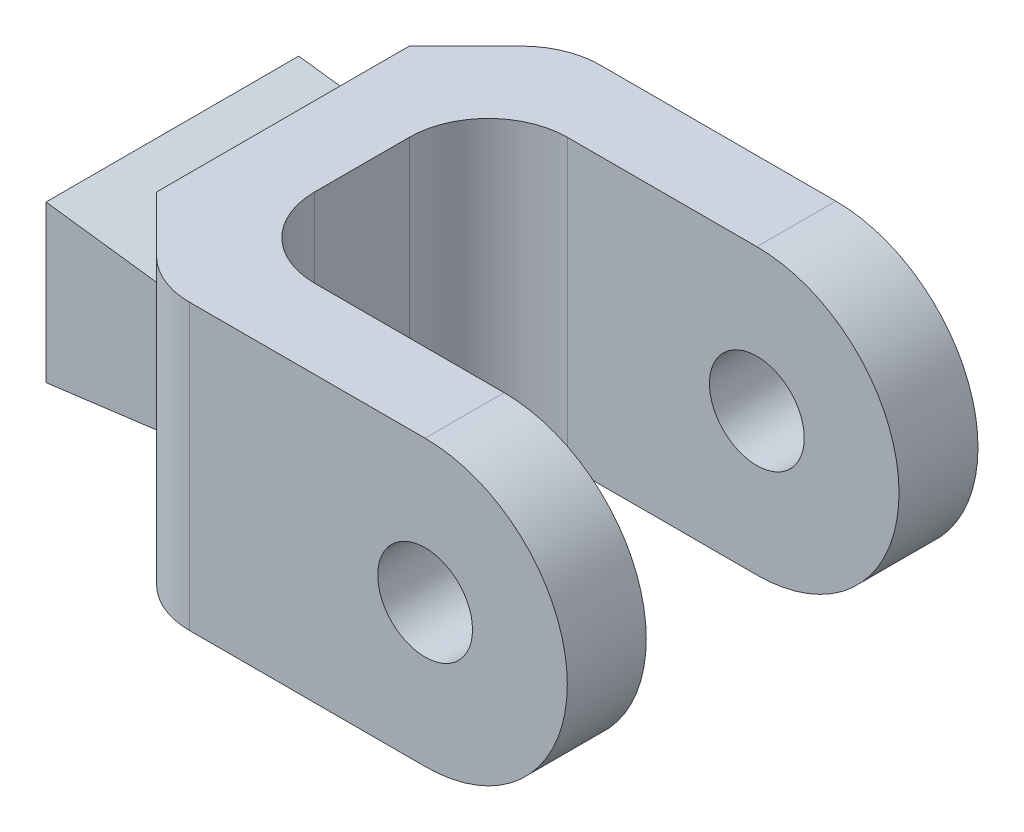
from build123d import *

# Parameters (mm, degrees)
BOSS_EXTRUDE1_DEPTH  = 8
SKETCH2_R            = 1.5
BOSS_EXTRUDE3_DEPTH  = 2.5
CUT_EXTRUDE2_DEPTH   = 20.54002303
FILLET5_R            = 2.5
FILLET6_R            = 2.5
FILLET5_OF_MIRROR2_R = 2.5
FILLET6_OF_MIRROR2_R = 2.5


with BuildPart() as part:
    # Sketch1 → Boss-Extrude1 (new body)
    with BuildSketch(Plane.XY):
        Polygon((-1.75, -2.475), (-1.75, 2.475), (1.75, 2.025), (1.75, 4.5), (4.25, 4.5), (4.25, -4.5), (1.75, -4.5), (1.75, -2.025), align=None)
    extrude(amount=BOSS_EXTRUDE1_DEPTH)

    # Sketch2 → Boss-Extrude3 (add)
    with BuildSketch(Plane.XY):
        with BuildLine():
            Line((12.75, -4.5), (1.75, -4.5))
            Line((1.75, -4.5), (1.75, 4.5))
            Line((1.75, 4.5), (12.75, 4.5))
            ThreePointArc((12.75, 4.5), (17.25, 0), (12.75, -4.5))
        make_face()
        with Locations((12.75, 0)):
            Circle(SKETCH2_R, mode=Mode.SUBTRACT)
    boss_extrude3 = extrude(amount=-BOSS_EXTRUDE3_DEPTH)

    # Sketch5 → Cut-Extrude2 (cut, symmetric)
    with BuildSketch(Plane(origin=(0, 0, 0), x_dir=(1, 0, 0), z_dir=(0, 1, 0))):
        Polygon((1.75, 0), (4.25, 2.5), (1.75, 2.5), align=None)
    cut_extrude2 = extrude(amount=CUT_EXTRUDE2_DEPTH, both=True, mode=Mode.SUBTRACT)

    # Fillet5
    fillet5_edges = [part.edges().sort_by_distance(p)[0] for p in [
        (4.25, 0, 0),
    ]]
    fillet(fillet5_edges, radius=FILLET5_R)

    # Fillet6
    fillet6_edges = [part.edges().sort_by_distance(p)[0] for p in [
        (4.25, 0, -2.5),
    ]]
    fillet(fillet6_edges, radius=FILLET6_R)

    # Mirror2: Boss-Extrude3, Cut-Extrude2 across plane
    add(boss_extrude3.mirror(Plane(origin=(0, 0, 4), x_dir=(1, 0, 0), z_dir=(0, 0, -1))))
    add(cut_extrude2.mirror(Plane(origin=(0, 0, 4), x_dir=(1, 0, 0), z_dir=(0, 0, -1))), mode=Mode.SUBTRACT)

    # Fillet5 of Mirror2
    fillet5_of_mirror2_edges = [part.edges().sort_by_distance(p)[0] for p in [
        (4.25, 0, 8),
    ]]
    fillet(fillet5_of_mirror2_edges, radius=FILLET5_OF_MIRROR2_R)

    # Fillet6 of Mirror2
    fillet6_of_mirror2_edges = [part.edges().sort_by_distance(p)[0] for p in [
        (4.25, 0, 10.5),
    ]]
    fillet(fillet6_of_mirror2_edges, radius=FILLET6_OF_MIRROR2_R)


solid = part.part
